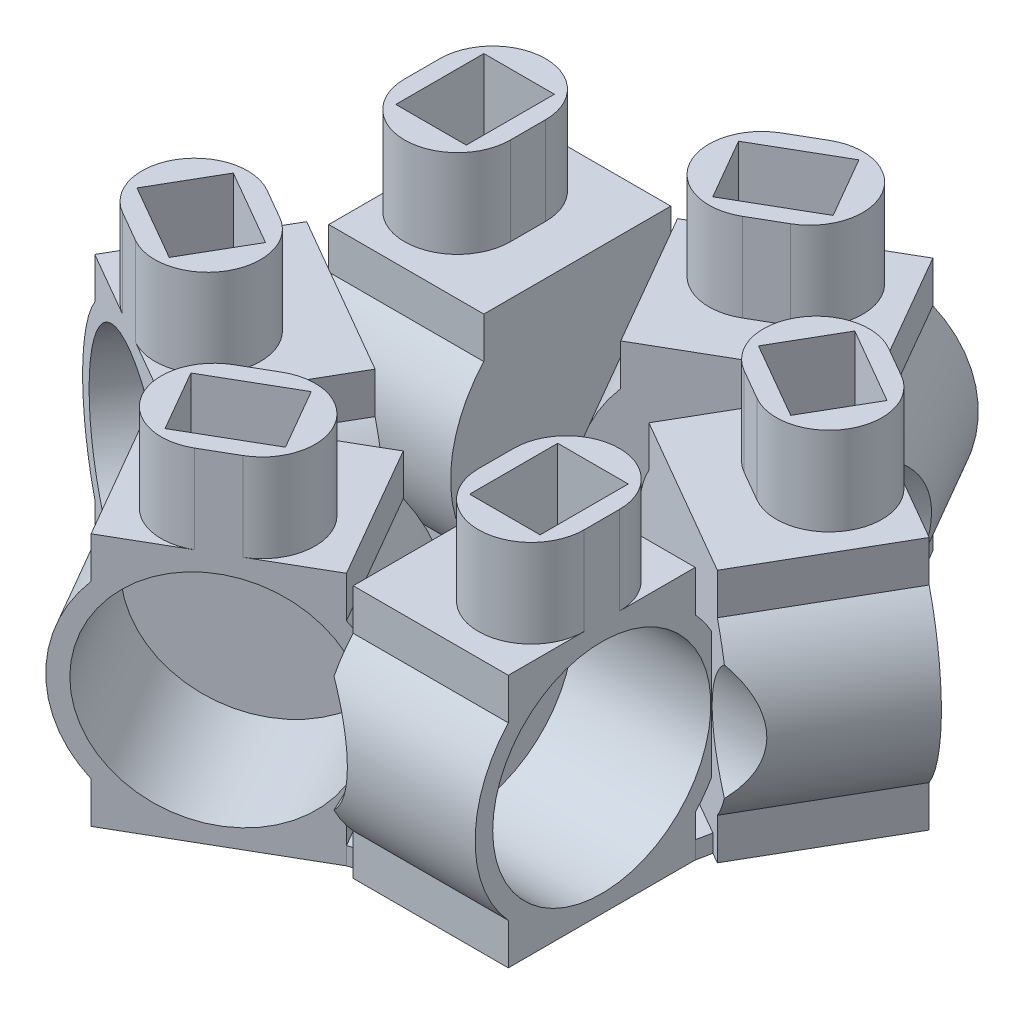
from build123d import *

# Parameters (mm, degrees)
SKETCH1_R                = 35.95
BOSS_EXTRUDE1_DEPTH      = 55.5
SHELL1_T                 = -5
BOSS_EXTRUDE2_REACH      = 99.685
BOSS_EXTRUDE2_END_RADIUS = 35.95
SKETCH2_W                = 111
SKETCH2_H                = 53.04
CUT_EXTRUDE1_REACH       = 99.685
CUT_EXTRUDE1_END_RADIUS  = 30.95
SKETCH3_W                = 20
SKETCH3_H                = 25
BOSS_EXTRUDE5_DEPTH      = 25
CUT_EXTRUDE2_REACH       = 119.313
SKETCH6_W                = 20
SKETCH6_H                = 25
CUT_EXTRUDE3_DEPTH       = 98.684504912
CUT_EXTRUDE3_DEPTH_BACK  = 98.684504912
SKETCH7_W                = 67
SKETCH7_H                = 71.9
SKETCH8_R                = 70
SKETCH8_R_2              = 60
EXTRUDE_THIN1_DEPTH      = 5
CIRPATTERN1_COUNT        = 6
SKETCH9_R                = 30.95
CUT_EXTRUDE4_DEPTH       = 202.992862618
CIRPATTERN4_COUNT        = 6


with BuildPart() as part:
    # Sketch1 → Boss-Extrude1 (new, symmetric)
    with BuildSketch(Plane(origin=(0, 0, 0), x_dir=(0, 0, -1), z_dir=(1, 0, 0))):
        Circle(SKETCH1_R)
    extrude(amount=BOSS_EXTRUDE1_DEPTH, both=True)

    # Shell1
    shell1_openings = [part.faces().sort_by_distance(p)[0] for p in [
        (55.5, 0, 0),
    ]]
    offset(amount=SHELL1_T, openings=shell1_openings, kind=Kind.INTERSECTION)

    # Boss-Extrude2: up to this cylinder (the profile starts outside it)
    boss_extrude2_end = Plane(origin=(0, 0, 0), z_dir=(-1, 0, 0)) * Cylinder(BOSS_EXTRUDE2_END_RADIUS, 272.27, mode=Mode.PRIVATE)
    # Sketch2 → Boss-Extrude2 (add, up to the surface)
    with BuildSketch(Plane(origin=(0, 35.95, 0), x_dir=(1, 0, 0), z_dir=(0, 1, 0)), mode=Mode.PRIVATE) as boss_extrude2_sk1:
        Rectangle(SKETCH2_W, SKETCH2_H)
    boss_extrude2_tool1 = extrude(boss_extrude2_sk1.sketch, amount=-BOSS_EXTRUDE2_REACH, mode=Mode.PRIVATE) - boss_extrude2_end
    boss_extrude2 = boss_extrude2_tool1.solids().sort_by_distance((0, 35.95, 0))[0] + boss_extrude2_tool1.solids().sort_by_distance((0, 35.95, 0))[1]
    add(boss_extrude2)

    # Mirror1: Boss-Extrude2 across plane
    add(boss_extrude2.mirror(Plane.ZX))

    # Cut-Extrude1: up to this cylinder (the profile starts outside it)
    cut_extrude1_end = Plane(origin=(-26.5, 0, 0), z_dir=(-1, 0, 0)) * Cylinder(CUT_EXTRUDE1_END_RADIUS, 262.27, mode=Mode.PRIVATE)
    # Sketch3 → Cut-Extrude1 (cut, up to the surface)
    with BuildSketch(Plane(origin=(0, 35.95, 0), x_dir=(1, 0, 0), z_dir=(0, 1, 0)), mode=Mode.PRIVATE) as cut_extrude1_sk1:
        with Locations((-26.5, 0)):
            Rectangle(SKETCH3_W, SKETCH3_H)
    cut_extrude1_tool1 = extrude(cut_extrude1_sk1.sketch, amount=-CUT_EXTRUDE1_REACH, mode=Mode.PRIVATE) - cut_extrude1_end
    add(cut_extrude1_tool1.solids().sort_by_distance((-26.5, 35.95, 0))[0], mode=Mode.SUBTRACT)

    # Sketch5 → Boss-Extrude5 (add)
    with BuildSketch(Plane(origin=(0, 35.95, 0), x_dir=(1, 0, 0), z_dir=(0, 1, 0))):
        with BuildLine():
            Line((-11.5, 5), (-11.5, -5))
            ThreePointArc((-11.5, -5), (-26.5, -20), (-41.5, -5))
            Line((-41.5, -5), (-41.5, 5))
            ThreePointArc((-41.5, 5), (-26.5, 20), (-11.5, 5))
        make_face()
    extrude(amount=BOSS_EXTRUDE5_DEPTH)

    # Sketch6 → Cut-Extrude2 (cut, up to next)
    with BuildSketch(Plane(origin=(0, 60.95, 0), x_dir=(1, 0, 0), z_dir=(0, 1, 0)), mode=Mode.PRIVATE) as cut_extrude2_sk1:
        with Locations((-26.5, 0)):
            Rectangle(SKETCH6_W, SKETCH6_H)
    cut_extrude2_tool1 = extrude(cut_extrude2_sk1.sketch, amount=-CUT_EXTRUDE2_REACH, mode=Mode.PRIVATE) & part.part
    add(cut_extrude2_tool1.solids().sort_by_distance((-26.5, 60.95, 0))[0], mode=Mode.SUBTRACT)

    # Sketch7 → Cut-Extrude3 (cut, two sides: drawn at the far end of the back side and taken through both)
    with BuildSketch(Plane(origin=(0, 35.95, 0), x_dir=(1, 0, 0), z_dir=(0, 1, 0)).offset(-CUT_EXTRUDE3_DEPTH_BACK)):
        with Locations((22, 0)):
            Rectangle(SKETCH7_W, SKETCH7_H)
    extrude(amount=CUT_EXTRUDE3_DEPTH + CUT_EXTRUDE3_DEPTH_BACK, mode=Mode.SUBTRACT)

    # Sketch8 → Extrude-Thin1 (add)
    with BuildSketch(Plane(origin=(0, -35.95, 0), x_dir=(1, 0, 0), z_dir=(0, 1, 0))):
        with Locations((-79.617651648, 42.644066919)):
            Circle(SKETCH8_R)
        with Locations((-79.617651648, 42.644066919)):
            Circle(SKETCH8_R_2, mode=Mode.SUBTRACT)
    extrude(amount=EXTRUDE_THIN1_DEPTH)


with BuildPart() as cirpattern1_1:
    # CirPattern1: pattern copy
    add(part.part.rotate(Axis((-79.617651648, 0, -42.644066919), (0, 1, 0)), 1 * 360 / CIRPATTERN1_COUNT))

    # Sketch9 → Cut-Extrude4 (cut, through all)
    with BuildSketch(Plane(origin=(-50.5, 0, 0), x_dir=(0, 0, -1), z_dir=(1, 0, 0))):
        with Locations(Location((0, 0, 0), (0, 0, 180))):
            Circle(SKETCH9_R)
    cut_extrude4 = extrude(amount=CUT_EXTRUDE4_DEPTH, mode=Mode.SUBTRACT)


with BuildPart() as cirpattern1_2:
    # CirPattern1: pattern copy
    add(part.part.rotate(Axis((-79.617651648, 0, -42.644066919), (0, 1, 0)), 2 * 360 / CIRPATTERN1_COUNT))


with BuildPart() as cirpattern1_3:
    # CirPattern1: pattern copy
    add(part.part.rotate(Axis((-79.617651648, 0, -42.644066919), (0, 1, 0)), 3 * 360 / CIRPATTERN1_COUNT))


with BuildPart() as cirpattern1_4:
    # CirPattern1: pattern copy
    add(part.part.rotate(Axis((-79.617651648, 0, -42.644066919), (0, 1, 0)), 4 * 360 / CIRPATTERN1_COUNT))


with BuildPart() as cirpattern1_5:
    # CirPattern1: pattern copy
    add(part.part.rotate(Axis((-79.617651648, 0, -42.644066919), (0, 1, 0)), 5 * 360 / CIRPATTERN1_COUNT))

    # Combine1: read off the stored shape, not the designer's step
    # Combine1: union CirPattern1_3, part, CirPattern1_2, CirPattern1_4, CirPattern1_1
    add(cirpattern1_3.part)
    add(part.part)
    add(cirpattern1_2.part)
    add(cirpattern1_4.part)
    add(cirpattern1_1.part)

    # CirPattern4: Cut-Extrude4 ×6 about axis
    cirpattern4_axis = Axis((-79.617651648, 0, -42.644066919), (0, -1, 0))
    for i in range(1, CIRPATTERN4_COUNT):
        add(cut_extrude4.rotate(cirpattern4_axis, i * 360 / CIRPATTERN4_COUNT), mode=Mode.SUBTRACT)


solid = cirpattern1_5.part
